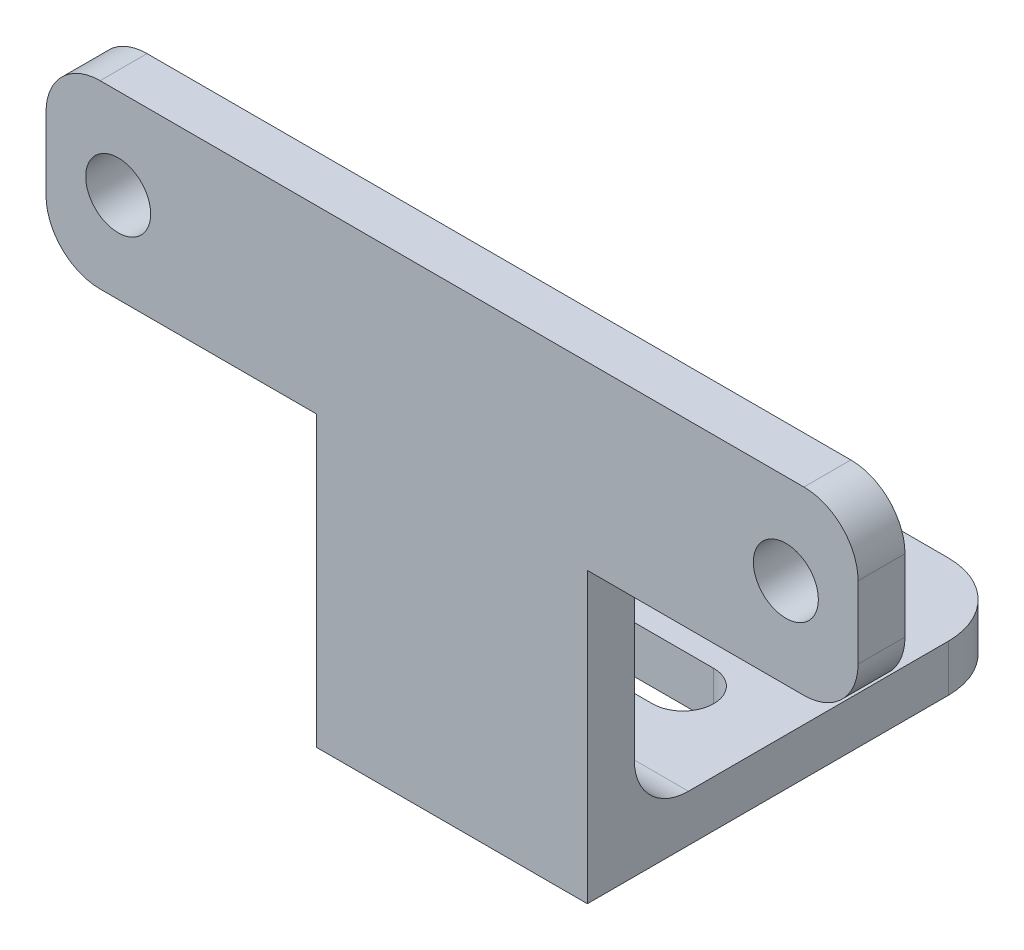
from build123d import *

# Parameters (mm, degrees)
SKETCH_2_W             = 15
SKETCH_2_H             = 24
EXTRUDE_1_DEPTH        = 2.6
SKETCH_5_W             = 15
SKETCH_5_H             = 13.4
EXTRUDE_2_DEPTH        = 2.6
FILLET_1_R             = 4
HOLE_WIZARD_M3_3_D     = 3.6
HOLE_WIZARD_M3_3_DEPTH = 32.75
HOLE_WIZARD_M3_3_TIP   = 1.081549114
FILLET_2_R             = 3
FILLET_3_R             = 3
HOLE_WIZARD_M3_5_DEPTH = 2.6


# Read off the part's stored shape, not the designer's step: M3 间隙槽口5
with BuildPart() as part:
    # 草图2 → 凸台-拉伸1 (new body)
    with BuildSketch(Plane(origin=(0, 0, 0), x_dir=(1, 0, 0), z_dir=(0, 1, 0))):
        with Locations((0, 12)):
            Rectangle(SKETCH_2_W, SKETCH_2_H)
    extrude(amount=EXTRUDE_1_DEPTH)

    # 草图5 → 凸台-拉伸2 (add)
    with BuildSketch(Plane.XY):
        with Locations((0, 9.3)):
            Rectangle(SKETCH_5_W, SKETCH_5_H)
        Polygon((-22.5, 16), (-7.5, 16), (7.5, 16), (22.5, 16), (22.5, 26), (-22.5, 26), align=None)
    extrude(amount=-EXTRUDE_2_DEPTH)

    # 圆角1
    fillet_1_edges = [part.edges().sort_by_distance(p)[0] for p in [
        (-7.5, 1.3, -24),
        (7.5, 1.3, -24),
    ]]
    fillet(fillet_1_edges, radius=FILLET_1_R)

    # M3 间隙槽口3
    with Locations(Plane.XY):
        with Locations((-18.5, 21), (18.5, 21)):
            Hole(HOLE_WIZARD_M3_3_D / 2, depth=HOLE_WIZARD_M3_3_DEPTH)
            with Locations((0, 0, -(HOLE_WIZARD_M3_3_DEPTH + HOLE_WIZARD_M3_3_TIP / 2))):  # 118° drill point
                Cone(0, HOLE_WIZARD_M3_3_D / 2, HOLE_WIZARD_M3_3_TIP, mode=Mode.SUBTRACT)

    # 圆角2
    fillet_2_edges = [part.edges().sort_by_distance(p)[0] for p in [
        (-22.5, 16, -1.3),
        (-22.5, 26, -1.3),
        (22.5, 26, -1.3),
        (22.5, 16, -1.3),
    ]]
    fillet(fillet_2_edges, radius=FILLET_2_R)

    # 圆角3
    fillet_3_edges = [part.edges().sort_by_distance(p)[0] for p in [
        (0, 2.6, -2.6),
    ]]
    fillet(fillet_3_edges, radius=FILLET_3_R)

    # M3 间隙槽口5 outline → M3 间隙槽口5 (cut)
    with BuildSketch(Plane(origin=(0, 0, 0), x_dir=(1, 0, 0), z_dir=(0, 1, 0))):
        with BuildLine():
            ThreePointArc((2.3, 8.8), (4, 10.5), (2.3, 12.2))
            Line((2.3, 12.2), (-2.3, 12.2))
            ThreePointArc((-2.3, 12.2), (-4, 10.5), (-2.3, 8.8))
            Line((-2.3, 8.8), (2.3, 8.8))
        make_face()
        with BuildLine():
            Line((-2.3, 16.8), (2.3, 16.8))
            ThreePointArc((2.3, 16.8), (4, 18.5), (2.3, 20.2))
            Line((2.3, 20.2), (-2.3, 20.2))
            ThreePointArc((-2.3, 20.2), (-4, 18.5), (-2.3, 16.8))
        make_face()
    extrude(amount=HOLE_WIZARD_M3_5_DEPTH, mode=Mode.SUBTRACT)


solid = part.part
